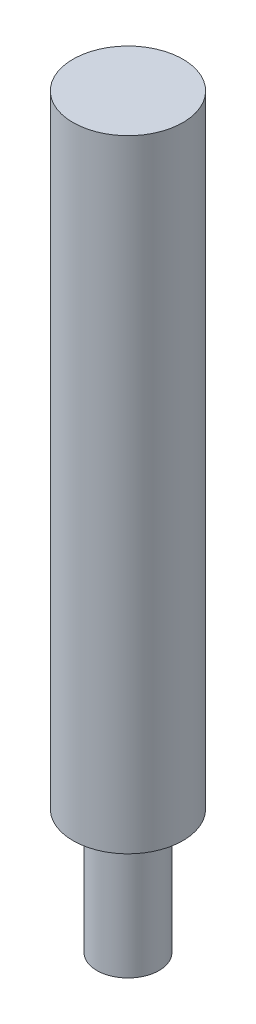
from build123d import *

# Parameters (mm, degrees)
SKETCH_1_R      = 1.5
EXTRUDE_1_DEPTH = 6
SKETCH_2_R      = 2.65
EXTRUDE_2_DEPTH = 30


with BuildPart() as part:
    # 草图1 → 凸台-拉伸1 (new body)
    with BuildSketch(Plane(origin=(0, 0, 0), x_dir=(1, 0, 0), z_dir=(0, 1, 0))):
        Circle(SKETCH_1_R)
    extrude(amount=EXTRUDE_1_DEPTH)

    # 草图2 → 凸台-拉伸2 (add)
    with BuildSketch(Plane(origin=(0, 6, 0), x_dir=(1, 0, 0), z_dir=(0, 1, 0))):
        Circle(SKETCH_2_R)
    extrude(amount=EXTRUDE_2_DEPTH)


solid = part.part
